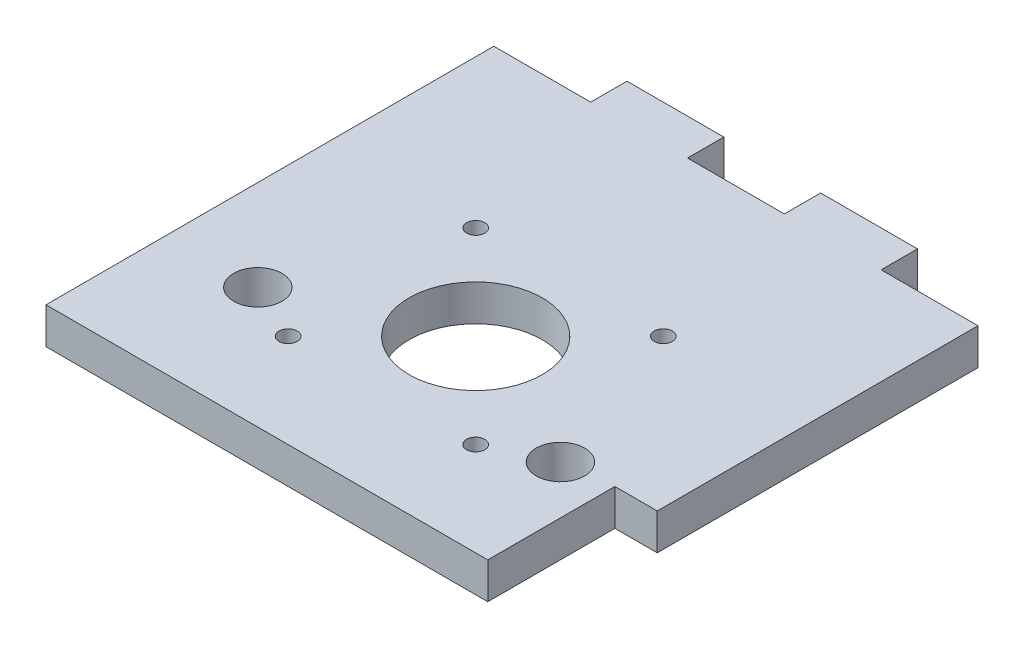
from build123d import *

# Parameters (mm, degrees)
SKETCH1_R           = 4
SKETCH1_R_2         = 1.5
BOSS_EXTRUDE1_DEPTH = 6
CUT_EXTRUDE1_REACH  = 65.537
SKETCH2_R           = 11
SKETCH3_W           = 21
SKETCH3_H           = 6
CUT_EXTRUDE2_DEPTH  = 7


with BuildPart() as part:
    # Sketch1 → Boss-Extrude1 (new body)
    with BuildSketch(Plane(origin=(0, 0, 0), x_dir=(1, 0, 0), z_dir=(0, 1, 0))):
        Polygon((-40, 43), (-24, 43), (-24, 49), (-8, 49), (-8, 43), (8, 43), (8, 49), (24, 49), (24, 43), (40, 43), (40, -31), (-40, -31), align=None)
        Circle(SKETCH1_R, mode=Mode.SUBTRACT)
        with Locations((15.5, 15.5)):
            Circle(SKETCH1_R_2, mode=Mode.SUBTRACT)
        with Locations((-15.5, 15.5)):
            Circle(SKETCH1_R_2, mode=Mode.SUBTRACT)
        with Locations((-15.5, -15.5)):
            Circle(SKETCH1_R_2, mode=Mode.SUBTRACT)
        with Locations((15.5, -15.5)):
            Circle(SKETCH1_R_2, mode=Mode.SUBTRACT)
        with Locations((-25, -11)):
            Circle(SKETCH1_R, mode=Mode.SUBTRACT)
        with Locations((25, -11)):
            Circle(SKETCH1_R, mode=Mode.SUBTRACT)
    extrude(amount=BOSS_EXTRUDE1_DEPTH)

    # Sketch2 → Cut-Extrude1 (cut, up to next)
    with BuildSketch(Plane(origin=(0, 6, 0), x_dir=(1, 0, 0), z_dir=(0, 1, 0)), mode=Mode.PRIVATE) as cut_extrude1_sk1:
        Circle(SKETCH2_R)
    cut_extrude1_tool1 = extrude(cut_extrude1_sk1.sketch, amount=-CUT_EXTRUDE1_REACH, mode=Mode.PRIVATE) & part.part
    add(cut_extrude1_tool1.solids().sort_by_distance((0, 6, 0))[0], mode=Mode.SUBTRACT)

    # Sketch3 → Cut-Extrude2 (cut)
    with BuildSketch(Plane(origin=(40, 0, 0), x_dir=(0, 0, -1), z_dir=(1, 0, 0))):
        with Locations((-20.5, 3)):
            Rectangle(SKETCH3_W, SKETCH3_H)
    extrude(amount=-CUT_EXTRUDE2_DEPTH, mode=Mode.SUBTRACT)


solid = part.part
